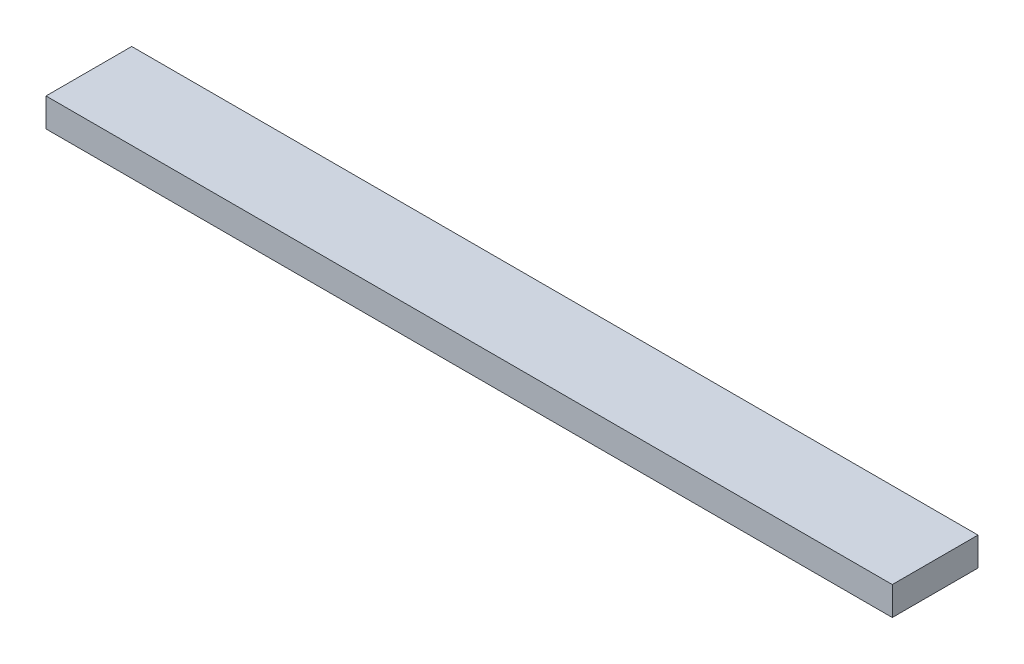
from build123d import *

# Parameters (mm, degrees)
SKETCH1_W           = 38.1
SKETCH1_H           = 12.7
BOSS_EXTRUDE1_DEPTH = 376.2


with BuildPart() as part:
    # Sketch1 → Boss-Extrude1 (new body)
    with BuildSketch(Plane(origin=(0, 0, 0), x_dir=(0, 0, -1), z_dir=(1, 0, 0))):
        with Locations((19.05, 6.35)):
            Rectangle(SKETCH1_W, SKETCH1_H)
    extrude(amount=BOSS_EXTRUDE1_DEPTH)


solid = part.part
